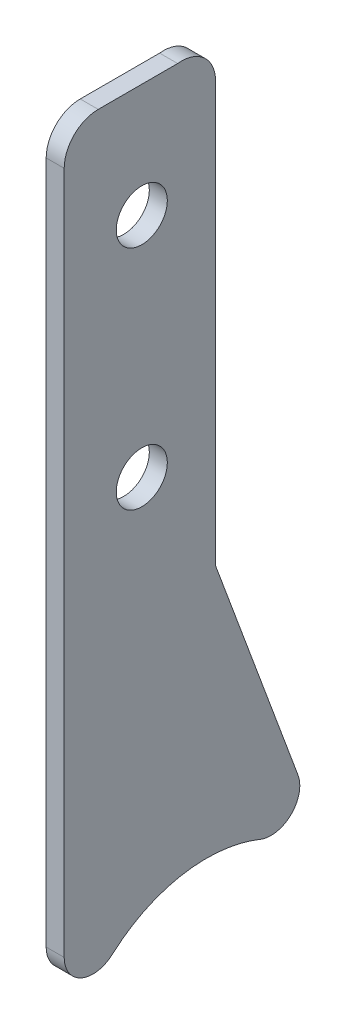
from build123d import *

# Parameters (mm, degrees)
SKETCH1_R            = 3.025
BOSS_EXTRUDE1_DEPTH  = 1.5875
FILLET1_START        = -1
FILLET1_DEPTH        = 4
M4_CLEARANCE_HOLE1_D = 4.5


with BuildPart() as part:
    # Sketch1 → Boss-Extrude1 (new body)
    # profile 1 of 4: a face of its own
    with BuildSketch(Plane(origin=(0, 0, 0), x_dir=(0, 0, -1), z_dir=(1, 0, 0))):
        with BuildLine():
            Line((541.51052412, 64.02688415), (530.217508306, 94.502121028))
            Line((530.217508306, 94.502121028), (516.877503621, 94.502121028))
            Line((516.877503621, 94.502121028), (516.877503621, 59.781603486))
            add(Edge.make_bspline(
                [(516.877503621, 59.781603486), (516.877503621, 66.224434359), (520.85597879, 70.389492112), (525.494944029, 71.935813858)],
                knots=[0.791503971, 0.791503971, 0.791503971, 0.791503971, 1, 1, 1, 1], degree=3, weights=[0.513780637, 0.559932173, 0.722005294, 1]))
            add(Edge.make_bspline(
                [(525.494944029, 71.935813858), (531.367057327, 73.893184958), (538.581630796, 71.930770882), (541.51052412, 64.02688415)],
                knots=[0, 0, 0, 0, 0.245758306, 0.245758306, 0.245758306, 0.245758306], degree=3, weights=[1, 0.672322259, 0.505703571, 0.500143936]))
        make_face()
    # profile 2 of 4: a face of its own
    with BuildSketch(Plane(origin=(0, 0, 0), x_dir=(0, 0, -1), z_dir=(1, 0, 0))):
        with BuildLine():
            Line((516.877503621, 131.502121028), (516.877503621, 94.502121028))
            Line((516.877503621, 94.502121028), (530.217508306, 94.502121028))
            Line((530.217508306, 94.502121028), (530.217508306, 131.502121028))
            ThreePointArc((530.217508306, 131.502121028), (529.222247158, 133.753333946), (526.877503621, 134.502121028))
            Line((526.877503621, 134.502121028), (519.877503621, 134.502121028))
            ThreePointArc((519.877503621, 134.502121028), (517.756183277, 133.623441372), (516.877503621, 131.502121028))
        make_face()
        with Locations((523.717508306, 104.502121028)):
            Circle(SKETCH1_R, mode=Mode.SUBTRACT)
        with Locations((523.717508306, 124.502121028)):
            Circle(SKETCH1_R, mode=Mode.SUBTRACT)
    # profile 3 of 4: a face of its own
    with BuildSketch(Plane(origin=(0, 0, 0), x_dir=(0, 0, -1), z_dir=(1, 0, 0))):
        with Locations((523.717508306, 104.502121028)):
            Circle(SKETCH1_R)
    # profile 4 of 4: a face of its own
    with BuildSketch(Plane(origin=(0, 0, 0), x_dir=(0, 0, -1), z_dir=(1, 0, 0))):
        with Locations((523.717508306, 124.502121028)):
            Circle(SKETCH1_R)
    extrude(amount=BOSS_EXTRUDE1_DEPTH)

    # Fillet1: read off the stored shape, not the designer's step
    # Fillet1 outline → Fillet1 (cut)
    with BuildSketch(Plane.YZ.offset(FILLET1_START)):
        with BuildLine():
            add(Edge.make_bspline(
                [(59.781603486, -516.877503621), (63.745099458, -516.877503621), (67.076255883, -518.543444616), (69.385969927, -521.114832125)],
                knots=[0.791503971, 0.791503971, 0.791503971, 0.791503971, 0.915480845, 0.915480845, 0.915480845, 0.915480845], degree=3, weights=[0.513780637, 0.541223477, 0.609653692, 0.719071281]))
            ThreePointArc((69.385969927, -521.114832125), (68.955807133, -518.383002389), (71.275593157, -516.877503621))
            Line((71.275593157, -516.877503621), (59.781603486, -516.877503621))
        make_face()
        with BuildLine():
            ThreePointArc((74.887594645, -537.485939312), (72.182937452, -536.873853395), (71.650054639, -534.152483223))
            add(Edge.make_bspline(
                [(71.650054639, -534.152483223), (70.307636138, -537.474178056), (67.681794337, -540.156147165), (64.02688415, -541.51052412)],
                knots=[1.132789983, 1.132789983, 1.132789983, 1.132789983, 1.245758306, 1.245758306, 1.245758306, 1.245758306], degree=3, weights=[0.609905504, 0.539286736, 0.502699547, 0.500143936]))
            Line((64.02688415, -541.51052412), (74.887594645, -537.485939312))
        make_face()
    extrude(amount=FILLET1_DEPTH, mode=Mode.SUBTRACT)

    # M4 Clearance Hole1 (through all)
    with Locations(Plane(origin=(1.5875, 0, 0), x_dir=(0, 0, -1), z_dir=(1, 0, 0))):
        with Locations((523.717508306, 124.502121028), (523.717508306, 104.502121028)):
            Hole(M4_CLEARANCE_HOLE1_D / 2)


solid = part.part
